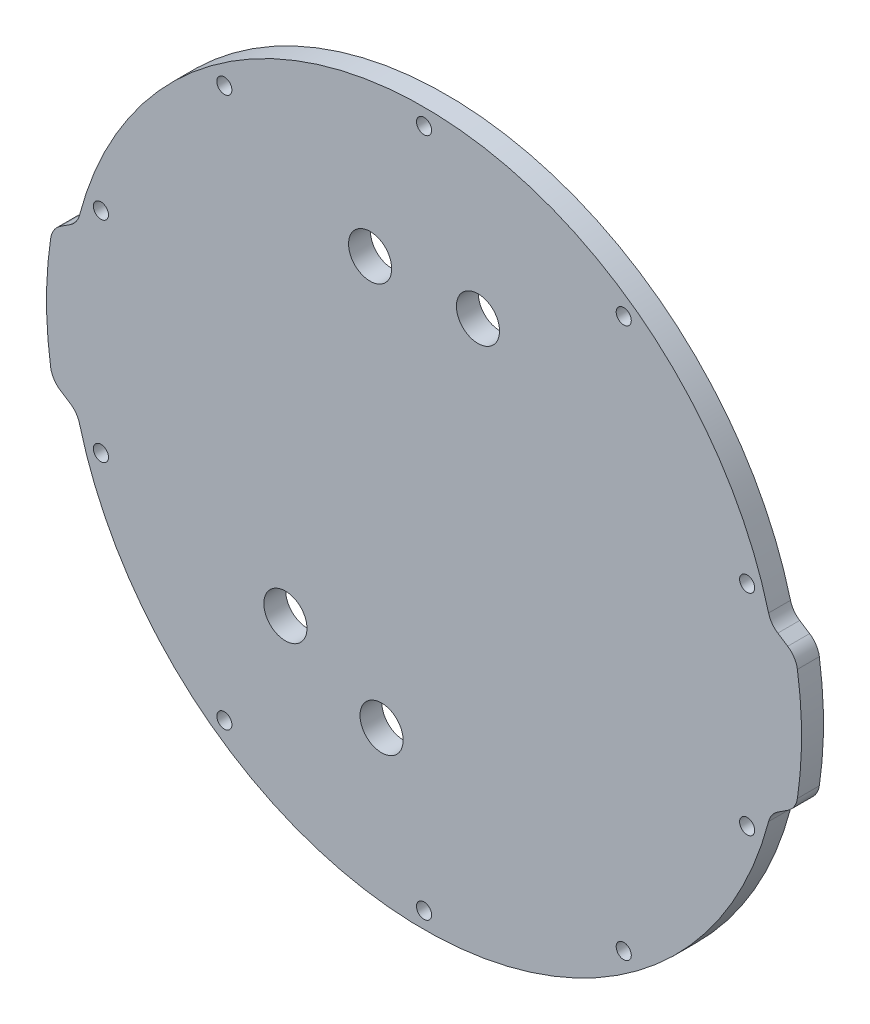
from build123d import *

# Parameters (mm, degrees)
SKETCH1_R           = 1.75
SKETCH1_R_2         = 5
BOSS_EXTRUDE1_DEPTH = 2.54
FILLET1_R           = 5.08


with BuildPart() as part:
    # Sketch1 → Boss-Extrude1 (new, symmetric)
    with BuildSketch(Plane.XY):
        with BuildLine():
            Line((-86.162592811, 15.24), (-80.321852568, 19.05))
            ThreePointArc((-80.321852568, 19.05), (0, 82.55), (80.321852568, 19.05))
            Line((80.321852568, 19.05), (86.162592811, 15.24))
            ThreePointArc((86.162592811, 15.24), (87.5, 0), (86.162592811, -15.24))
            Line((86.162592811, -15.24), (80.321852568, -19.05))
            ThreePointArc((80.321852568, -19.05), (0, -82.55), (-80.321852568, -19.05))
            Line((-80.321852568, -19.05), (-86.162592811, -15.24))
            ThreePointArc((-86.162592811, -15.24), (-87.5, 0), (-86.162592811, 15.24))
        make_face()
        with Locations((0, 78.74)):
            Circle(SKETCH1_R, mode=Mode.SUBTRACT)
        with Locations((46.282210766, 63.701998137)):
            Circle(SKETCH1_R, mode=Mode.SUBTRACT)
        with Locations((74.886190093, 24.331998137)):
            Circle(SKETCH1_R, mode=Mode.SUBTRACT)
        with Locations((74.886190093, -24.331998137)):
            Circle(SKETCH1_R, mode=Mode.SUBTRACT)
        with Locations((46.282210766, -63.701998137)):
            Circle(SKETCH1_R, mode=Mode.SUBTRACT)
        with Locations((0, -78.74)):
            Circle(SKETCH1_R, mode=Mode.SUBTRACT)
        with Locations((-46.282210766, -63.701998137)):
            Circle(SKETCH1_R, mode=Mode.SUBTRACT)
        with Locations((-74.886190093, -24.331998137)):
            Circle(SKETCH1_R, mode=Mode.SUBTRACT)
        with Locations((-74.886190093, 24.331998137)):
            Circle(SKETCH1_R, mode=Mode.SUBTRACT)
        with Locations((-46.282210766, 63.701998137)):
            Circle(SKETCH1_R, mode=Mode.SUBTRACT)
        with Locations((-32.134671235, -35.656176248)):
            Circle(SKETCH1_R_2, mode=Mode.SUBTRACT)
        with Locations((-9.845967479, -46.979324435)):
            Circle(SKETCH1_R_2, mode=Mode.SUBTRACT)
        with Locations((-12.5, 46.343823752)):
            Circle(SKETCH1_R_2, mode=Mode.SUBTRACT)
        with Locations((12.5, 46.343823752)):
            Circle(SKETCH1_R_2, mode=Mode.SUBTRACT)
    extrude(amount=BOSS_EXTRUDE1_DEPTH, both=True)

    # Fillet1
    fillet1_edges = [part.edges().sort_by_distance(p)[0] for p in [
        (-86.162592811, 15.24, 0),
        (-80.321852568, 19.05, 0),
        (-86.162592811, -15.24, 0),
        (-80.321852568, -19.05, 0),
        (86.162592811, -15.24, 0),
        (80.321852568, -19.05, 0),
        (86.162592811, 15.24, 0),
        (80.321852568, 19.05, 0),
    ]]
    fillet(fillet1_edges, radius=FILLET1_R)


solid = part.part
